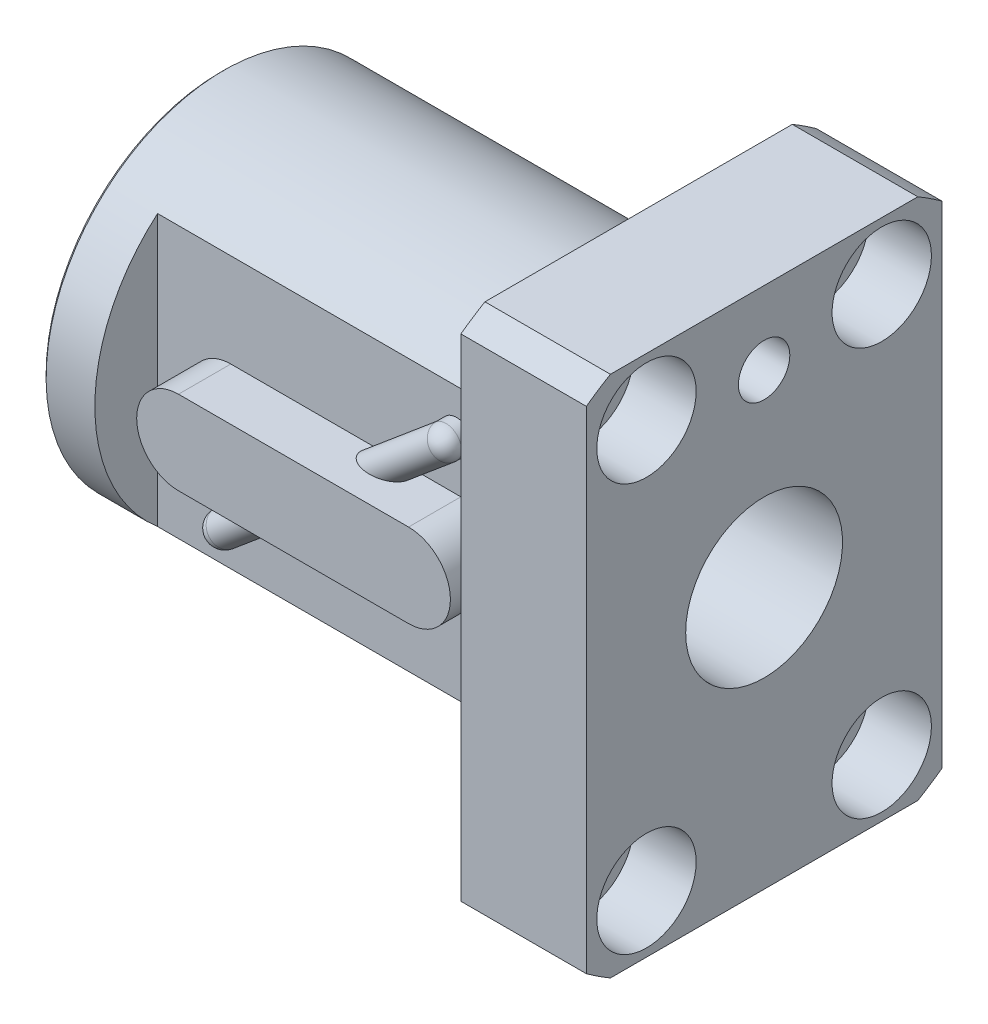
from build123d import *

# Parameters (mm, degrees)
CUT_EXTRUDE1_DEPTH                 = 58.28874235
CHAMFER1_SIZE                      = 0.34
SOCKET_HEAD_CAP_SCREW1_D           = 6
SOCKET_HEAD_CAP_SCREW1_CBORE_D     = 9.5
SOCKET_HEAD_CAP_SCREW1_CBORE_DEPTH = 6
CUT_EXTRUDE2_DEPTH                 = 35
BOSS_EXTRUDE1_DEPTH                = 5
SKETCH7_R                          = 1.5
BOSS_EXTRUDE2_DEPTH                = 1
REVOLVE3_ANGLE                     = 90
REVOLVE4_ANGLE                     = 90
TAP1_START                         = 4.7999999
TAP1_OUTLINE_R                     = 2.4585
TAP1_DEPTH                         = 7.2000001


# Read off the part's stored shape, not the designer's step: Tap1
with BuildPart() as part:
    # Sketch1 → Revolve1 (revolve)
    with BuildSketch(Plane.XY, mode=Mode.PRIVATE) as revolve1_sk:
        Polygon((0, 29), (12, 29), (12, 7.5), (-40, 7.5), (-40, 17), (-0.8, 17), (-0.8, 16.32), (0, 16.32), align=None)
    revolve(revolve1_sk.sketch.rotate(Axis((-40, 0, 0), (1, 0, 0)), 90), axis=Axis((-40, 0, 0), (1, 0, 0)))

    # Sketch2 → Cut-Extrude1 (cut, through all)
    with BuildSketch(Plane(origin=(0, 0, 0), x_dir=(0, 0, -1), z_dir=(1, 0, 0))):
        with BuildLine():
            Line((14.696938457, 25), (-14.696938457, 25))
            ThreePointArc((-14.696938457, 25), (0, 29), (14.696938457, 25))
        make_face()
        with BuildLine():
            Line((17, 23.494680249), (17, -23.494680249))
            ThreePointArc((17, -23.494680249), (29, 0), (17, 23.494680249))
        make_face()
        with BuildLine():
            Line((14.696938457, -25), (-14.696938457, -25))
            ThreePointArc((-14.696938457, -25), (0, -29), (14.696938457, -25))
        make_face()
        with BuildLine():
            Line((-17, -23.494680249), (-17, 23.494680249))
            ThreePointArc((-17, 23.494680249), (-29, 0), (-17, -23.494680249))
        make_face()
    extrude(amount=CUT_EXTRUDE1_DEPTH, mode=Mode.SUBTRACT)

    # Chamfer1
    chamfer1_edges = [part.edges().sort_by_distance(p)[0] for p in [
        (-40, 0, -17),
    ]]
    chamfer(chamfer1_edges, length=CHAMFER1_SIZE)

    # Socket Head Cap Screw1 (through all)
    with Locations(Plane(origin=(12, 0, 0), x_dir=(0, 0, -1), z_dir=(1, 0, 0))):
        with Locations((-11.25, 19.485571585), (11.25, -19.485571585), (-11.25, -19.485571585), (11.25, 19.485571585)):
            CounterBoreHole(SOCKET_HEAD_CAP_SCREW1_D / 2, SOCKET_HEAD_CAP_SCREW1_CBORE_D / 2, SOCKET_HEAD_CAP_SCREW1_CBORE_DEPTH)

    # Sketch5 → Cut-Extrude2 (cut)
    with BuildSketch(Plane(origin=(0, 0, 0), x_dir=(0, 0, -1), z_dir=(1, 0, 0))):
        with BuildLine():
            Line((-11, -12.961481397), (-11, 12.961481397))
            ThreePointArc((-11, 12.961481397), (-17, 0), (-11, -12.961481397))
        make_face()
    extrude(amount=-CUT_EXTRUDE2_DEPTH, mode=Mode.SUBTRACT)

    # Sketch6 → Boss-Extrude1 (add)
    with BuildSketch(Plane(origin=(0, 0, 11), x_dir=(-1, 0, 0), z_dir=(0, 0, -1))):
        with BuildLine():
            Line((6, 4), (28, 4))
            ThreePointArc((28, 4), (32, 0), (28, -4))
            Line((28, -4), (6, -4))
            ThreePointArc((6, -4), (2, 0), (6, 4))
        make_face()
    extrude(amount=-BOSS_EXTRUDE1_DEPTH)

    # Sketch7 → Boss-Extrude2 (add)
    with BuildSketch(Plane(origin=(0, 0, 11), x_dir=(-1, 0, 0), z_dir=(0, 0, -1))):
        with Locations(Location((27.571413315, -8.870469014, 0), (0, 0, 180))):
            Circle(SKETCH7_R)
        with Locations(Location((6.428586685, 8.870469014, 0), (0, 0, 180))):
            Circle(SKETCH7_R)
    extrude(amount=-BOSS_EXTRUDE2_DEPTH)

    # Sketch8 → Revolve2 (revolve)
    with BuildSketch(Plane.XY.offset(12)):
        Polygon((-27.571413315, -8.870469014), (-6.428586685, 8.870469014), (-7.392768099, 10.019535678), (-28.53559473, -7.721402349), align=None)
    revolve(axis=Axis((-27.571413315, -8.870469014, 12), (0.7660444431189788, 0.6427876096865385, 0)))

    # Sketch9 → Revolve3 (revolve)
    with BuildSketch(Plane.XY.offset(12)):
        with BuildLine():
            Line((-26.607231901, -10.019535678), (-28.53559473, -7.721402349))
            ThreePointArc((-28.53559473, -7.721402349), (-28.72047998, -9.834650428), (-26.607231901, -10.019535678))
        make_face()
    revolve(axis=Axis((-26.607231901, -10.019535678, 12), (-0.6427876096865375, 0.7660444431189796, 0)), revolution_arc=REVOLVE3_ANGLE)

    # Sketch10 → Revolve4 (revolve)
    with BuildSketch(Plane.XY.offset(12)):
        with BuildLine():
            Line((-7.392768099, 10.019535678), (-5.46440527, 7.721402349))
            ThreePointArc((-5.46440527, 7.721402349), (-5.27952002, 9.834650428), (-7.392768099, 10.019535678))
        make_face()
    revolve(axis=Axis((-7.392768099, 10.019535678, 12), (0.6427876096865389, -0.7660444431189785, 0)), revolution_arc=REVOLVE4_ANGLE)

    # Sketch11 → Cut-Revolve1 (revolve, cut)
    with BuildSketch(Plane.XY, mode=Mode.PRIVATE) as cut_revolve1_sk:
        with BuildLine():
            Line((2.3, 0), (4.8, 0))
            Line((4.8, 0), (4.8, 20.4585))
            ThreePointArc((4.8, 20.4585), (3.032233047, 19.726266953), (2.3, 17.9585))
            Line((2.3, 17.9585), (2.3, 0))
        make_face()
    revolve(cut_revolve1_sk.sketch.rotate(Axis((4.8, 0, 0), (0, 1, 0)), 270), axis=Axis((4.8, 0, 0), (0, 1, 0)), mode=Mode.SUBTRACT)

    # Tap1 outline → Tap1 (cut)
    with BuildSketch(Plane.YZ.offset(TAP1_START)):
        with Locations((18, 0)):
            Circle(TAP1_OUTLINE_R)
    extrude(amount=TAP1_DEPTH, mode=Mode.SUBTRACT)


solid = part.part
